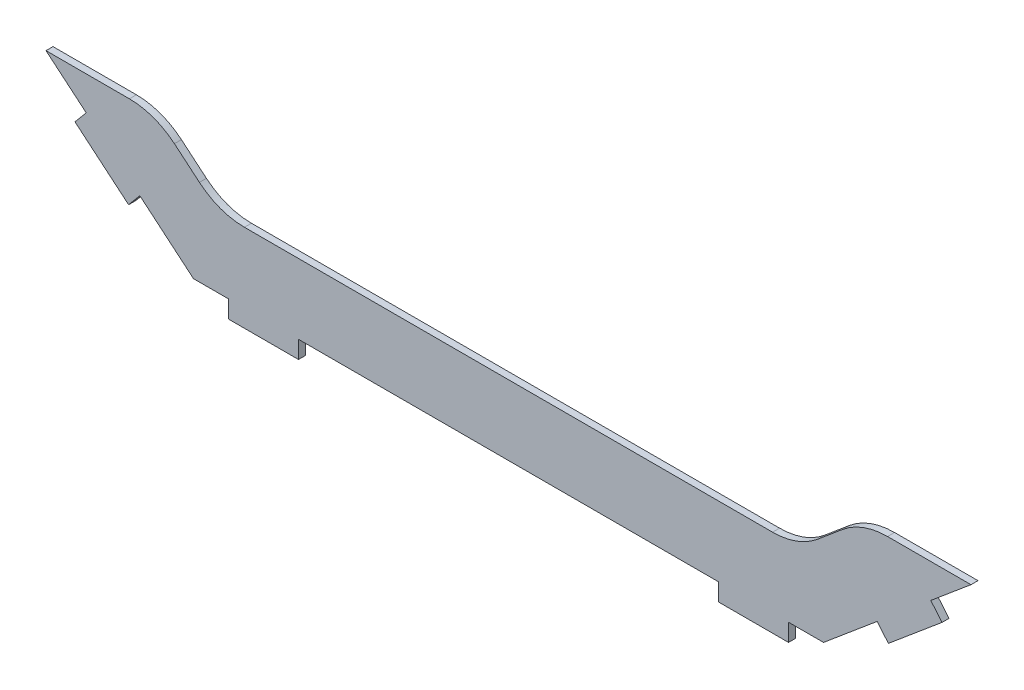
from build123d import *

# Parameters (mm, degrees)
BOSS_EXTRUDE1_DEPTH = 0.05
FILLET1_R           = 1


with BuildPart() as part:
    # frame_outline → Boss-Extrude1 (new, symmetric)
    with BuildSketch(Plane.XY):
        Polygon((0, 0), (3, 0), (3, -0.25), (4, -0.25), (4, 0), (4.5, 0), (5.266044443, 0.64278761), (5.426741346, 0.451276499), (6.192785789, 1.094064109), (6.032088886, 1.285575219), (6.606622219, 1.767665927), (5.050898392, 1.767665927), (4.136029766, 1), (-4.136029766, 1), (-5.050898392, 1.767665927), (-6.606622219, 1.767665927), (-6.032088886, 1.285575219), (-6.192785789, 1.094064109), (-5.426741346, 0.451276499), (-5.266044443, 0.64278761), (-4.5, 0), (-4, 0), (-4, -0.25), (-3, -0.25), (-3, 0), align=None)
    extrude(amount=BOSS_EXTRUDE1_DEPTH, both=True)

    # Fillet1
    fillet1_edges = [part.edges().sort_by_distance(p)[0] for p in [
        (4.136029766, 1, 0),
        (5.050898392, 1.767665927, 0),
        (-4.136029766, 1, 0),
        (-5.050898392, 1.767665927, 0),
    ]]
    fillet(fillet1_edges, radius=FILLET1_R)


solid = part.part
